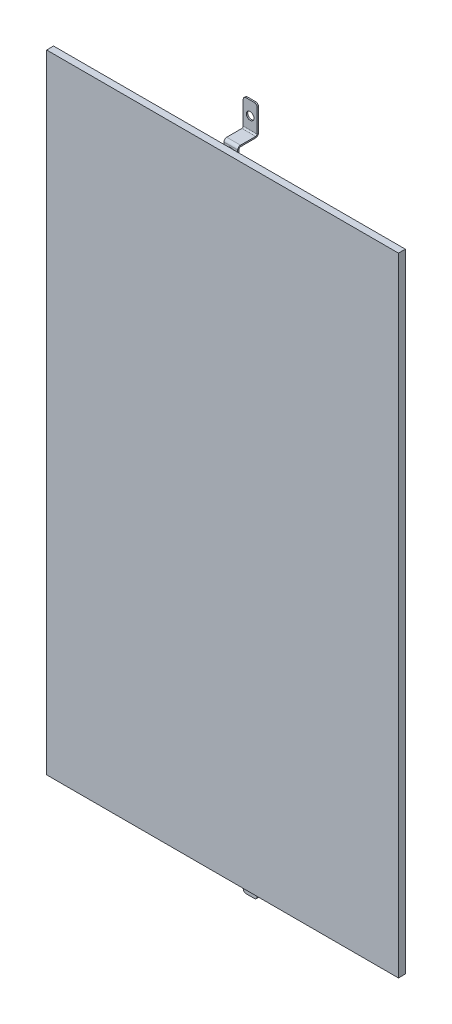
from build123d import *
from build123d.topology import SkipClean

# Parameters (mm, degrees)
SKETCH1_W           = 255
SKETCH1_H           = 455
BOSS_EXTRUDE1_DEPTH = 5
BASE_FLANGE2_DEPTH  = 1
JOG1_START          = 145
JOG1_DEPTH          = 10
JOG1_START_2        = 147
JOG1_2_DEPTH        = 6
JOG1_START_3        = -8
JOG1_3_DEPTH        = 1.976704963
JOG1_START_4        = -20
JOG1_4_OUTLINE_W    = 2
JOG1_4_OUTLINE_H    = 1
JOG1_4_DEPTH        = 12.160683996
JOG1_START_5        = -7
JOG1_5_DEPTH        = 1
JOG1_6_DEPTH        = 10
JOG1_7_DEPTH        = 10
SKETCH16_R          = 2.75
CUT_EXTRUDE2_DEPTH  = 1
SKETCH17_R          = 4
BOSS_EXTRUDE2_DEPTH = 1


with BuildPart() as part:
    # Sketch1 → Boss-Extrude1 (new body)
    with BuildSketch(Plane.XY):
        with Locations((150, 250)):
            Rectangle(SKETCH1_W, SKETCH1_H)
    extrude(amount=-BOSS_EXTRUDE1_DEPTH)


with BuildPart() as body_2:
    # Base-Flange2: sheet metal written as solids
    # Sketch8 → Base-Flange2 (new body)
    with BuildSketch(Plane(origin=(0, 0, -21), x_dir=(-1, 0, 0), z_dir=(0, 0, -1))):
        with BuildLine():
            Line((-153, 34.18), (-147, 34.18))
            ThreePointArc((-147, 34.18), (-145.585786438, 33.594213562), (-145, 32.18))
            Line((-145, 32.18), (-145, 2.18))
            ThreePointArc((-145, 2.18), (-145.585786438, 0.765786438), (-147, 0.18))
            Line((-147, 0.18), (-153, 0.18))
            ThreePointArc((-153, 0.18), (-154.414213562, 0.765786438), (-155, 2.18))
            Line((-155, 2.18), (-155, 32.18))
            ThreePointArc((-155, 32.18), (-154.414213562, 33.594213562), (-153, 34.18))
        make_face()
    extrude(amount=-BASE_FLANGE2_DEPTH)

    # Jog1: read off the stored shape, not the designer's step
    # Jog1 outline → Jog1 (cut)
    with BuildSketch(Plane.YZ.offset(JOG1_START)):
        with BuildLine():
            Line((34.18, -20), (20.733953562, -20))
            ThreePointArc((20.733953562, -20), (20.001902755, -20.732050807), (19.001902755, -21))
            Line((19.001902755, -21), (34.18, -21))
            Line((34.18, -21), (34.18, -20))
        make_face()
    extrude(amount=JOG1_DEPTH, mode=Mode.SUBTRACT)

    # Jog1 2 outline → Jog1 2 (add)
    with BuildSketch(Plane.YZ.offset(JOG1_START_2)):
        with BuildLine():
            Line((20.001902755, -8), (20.001902755, -19))
            ThreePointArc((20.001902755, -19), (19.709009536, -19.707106781), (19.001902755, -20))
            Line((19.001902755, -20), (20.733953562, -20))
            ThreePointArc((20.733953562, -20), (20.933754407, -19.51763809), (21.001902755, -19))
            Line((21.001902755, -19), (21.001902755, -8))
            ThreePointArc((21.001902755, -8), (21.294795974, -7.292893219), (22.001902755, -7))
            Line((22.001902755, -7), (34.18, -7))
            Line((34.18, -7), (34.18, -6))
            Line((34.18, -6), (22.001902755, -6))
            ThreePointArc((22.001902755, -6), (20.587689193, -6.585786438), (20.001902755, -8))
        make_face()
    extrude(amount=JOG1_2_DEPTH)

    # Jog1 3 outline → Jog1 3 (add)
    with BuildSketch(Plane.XY.offset(JOG1_START_3)):
        with BuildLine():
            Line((145, 20.001902755), (147, 20.001902755))
            Line((147, 20.001902755), (147, 34.18))
            ThreePointArc((147, 34.18), (145.585786438, 33.594213562), (145, 32.18))
            Line((145, 32.18), (145, 20.001902755))
        make_face()
        with BuildLine():
            Line((153, 20.001902755), (155, 20.001902755))
            Line((155, 20.001902755), (155, 32.18))
            ThreePointArc((155, 32.18), (154.414213562, 33.594213562), (153, 34.18))
            Line((153, 34.18), (153, 20.001902755))
        make_face()
    extrude(amount=JOG1_3_DEPTH)

    # Jog1 4 outline → Jog1 4 (add)
    with BuildSketch(Plane.XY.offset(JOG1_START_4)):
        with Locations((146, 20.501902755)):
            Rectangle(JOG1_4_OUTLINE_W, JOG1_4_OUTLINE_H)
        with Locations((154, 20.501902755)):
            Rectangle(JOG1_4_OUTLINE_W, JOG1_4_OUTLINE_H)
    extrude(amount=JOG1_4_DEPTH)

    # Jog1 5 outline → Jog1 5 (add)
    with BuildSketch(Plane.XY.offset(JOG1_START_5)):
        with BuildLine():
            Line((145, 32.18), (145, 21.001902755))
            Line((145, 21.001902755), (147, 21.001902755))
            Line((147, 21.001902755), (147, 34.18))
            ThreePointArc((147, 34.18), (145.585786438, 33.594213562), (145, 32.18))
        make_face()
        with BuildLine():
            Line((153, 34.18), (153, 21.001902755))
            Line((153, 21.001902755), (155, 21.001902755))
            Line((155, 21.001902755), (155, 32.18))
            ThreePointArc((155, 32.18), (154.414213562, 33.594213562), (153, 34.18))
        make_face()
    extrude(amount=JOG1_5_DEPTH)

    # Jog1 6 outline → Jog1 6 (cut)
    with SkipClean():  # the faces are left unmerged after this step: merging them gives an invalid solid
        with BuildSketch(Plane.YZ.offset(JOG1_START)):
            with BuildLine():
                Line((20.001902755, -6.023295037), (20.001902755, -8))
                ThreePointArc((20.001902755, -8), (20.587689193, -6.585786438), (22.001902755, -6))
                Line((22.001902755, -6), (36, -5.999999991))
                Line((36, -5.999999991), (36, -5))
                Line((36, -5), (21.001902764, -5))
                Line((21.001902764, -5), (21.001902763, -6))
                Line((21.001902763, -6), (21.001902755, -6.023295037))
                Line((21.001902755, -6.023295037), (20.001902755, -6.023295037))
            make_face()
            with BuildLine():
                ThreePointArc((20.733953562, -20), (20.416116315, -20.414213564), (20.001902751, -20.732050809))
                Line((20.001902751, -20.732050809), (20.001902747, -21))
                Line((20.001902747, -21), (36, -21))
                Line((36, -21), (36, -7))
                Line((36, -7), (22.001902755, -7))
                ThreePointArc((22.001902755, -7), (21.294795974, -7.292893219), (21.001902755, -8))
                Line((21.001902755, -8), (21.001902755, -19))
                ThreePointArc((21.001902755, -19), (20.933754407, -19.51763809), (20.733953562, -20))
            make_face()
        extrude(amount=JOG1_6_DEPTH, mode=Mode.SUBTRACT)
    add(body_2.part.scale(1), mode=Mode.REPLACE)  # the faces are merged on a copy

    # Jog1 7 outline → Jog1 7 (add)
    with BuildSketch(Plane.YZ.offset(JOG1_START)):
        with BuildLine():
            Line((20.001902755, -20), (20.001902755, -19))
            ThreePointArc((20.001902755, -19), (19.709009536, -19.707106781), (19.001902755, -20))
            Line((19.001902755, -20), (18, -20.000000001))
            Line((18, -20.000000001), (18, -21))
            Line((18, -21), (19.001902755, -21))
            ThreePointArc((19.001902755, -21), (19.519540843, -20.931851653), (20.001902751, -20.732050809))
            Line((20.001902751, -20.732050809), (20.001902755, -20))
        make_face()
    extrude(amount=JOG1_7_DEPTH)

    # Sketch16 → Cut-Extrude2 (cut)
    with BuildSketch(Plane.XY.offset(-20)):
        with Locations((150, 10.18)):
            Circle(SKETCH16_R)
    extrude(amount=-CUT_EXTRUDE2_DEPTH, mode=Mode.SUBTRACT)


with BuildPart() as body_3:
    # Sketch17 → Boss-Extrude2 (new body)
    with BuildSketch(Plane.XY.offset(-6)):
        with Locations((150, 27.090951377)):
            Circle(SKETCH17_R)
    extrude(amount=BOSS_EXTRUDE2_DEPTH)


with BuildPart() as body_4:
    # Mirror1: mirrored copy
    add(body_2.part.mirror(Plane(origin=(0, 250, 0), x_dir=(0, 0, 1), z_dir=(0, -1, 0))))


with BuildPart() as body_5:
    # Mirror1 2: mirrored copy
    add(body_3.part.mirror(Plane(origin=(0, 250, 0), x_dir=(0, 0, 1), z_dir=(0, -1, 0))))


solid = Compound([part.part, body_2.part, body_3.part, body_4.part, body_5.part])
